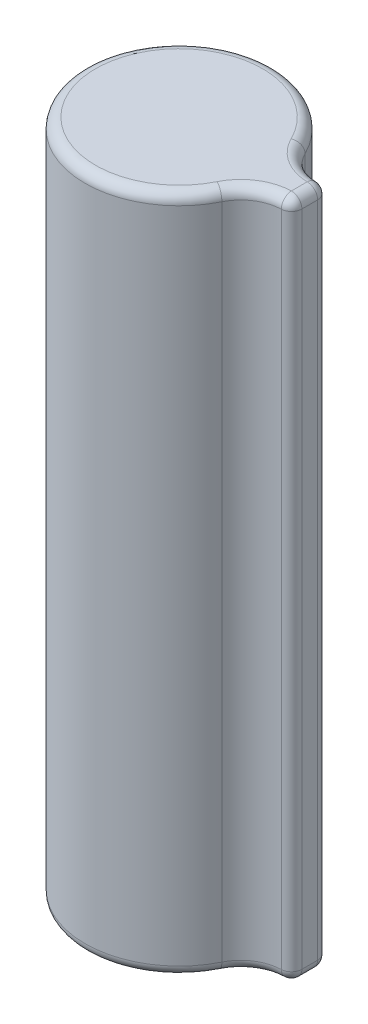
from build123d import *

# Parameters (mm, degrees)
EXTRUDE_1_DEPTH = 65
FILLET_1_R      = 4
FILLET_2_R      = 1
FILLET_3_R      = 1


with BuildPart() as part:
    # 草图1 → 凸台-拉伸1 (new body)
    with BuildSketch(Plane(origin=(0, 0, 0), x_dir=(1, 0, 0), z_dir=(0, 1, 0))):
        with BuildLine():
            Line((5.896241987, -1.75), (5.896241987, 1.75))
            Line((5.896241987, 1.75), (8.828221792, 1.75))
            ThreePointArc((8.828221792, 1.75), (-9, 0), (8.828221792, -1.75))
            Line((8.828221792, -1.75), (5.896241987, -1.75))
        make_face()
        with BuildLine():
            Line((8.828221792, 1.75), (5.896241987, 1.75))
            Line((5.896241987, 1.75), (5.896241987, -1.75))
            Line((5.896241987, -1.75), (8.828221792, -1.75))
            ThreePointArc((8.828221792, -1.75), (8.956952499, -0.879205288), (9, 0))
            ThreePointArc((9, 0), (8.956952499, 0.879205288), (8.828221792, 1.75))
        make_face()
        with BuildLine():
            Line((12.5, 1.75), (8.828221792, 1.75))
            ThreePointArc((8.828221792, 1.75), (8.956952499, 0.879205288), (9, 0))
            ThreePointArc((9, 0), (8.956952499, -0.879205288), (8.828221792, -1.75))
            Line((8.828221792, -1.75), (12.5, -1.75))
            Line((12.5, -1.75), (12.5, 1.75))
        make_face()
    extrude(amount=EXTRUDE_1_DEPTH)

    # 圆角1
    fillet_1_edges = [part.edges().sort_by_distance(p)[0] for p in [
        (8.828221792, 32.5, -1.75),
        (8.828221792, 32.5, 1.75),
    ]]
    fillet(fillet_1_edges, radius=FILLET_1_R)

    # 圆角2
    fillet_2_edges = [part.edges().sort_by_distance(p)[0] for p in [
        (12.5, 32.5, 1.75),
        (12.5, 32.5, -1.75),
    ]]
    fillet(fillet_2_edges, radius=FILLET_2_R)

    # 圆角3
    fillet_3_edges = [part.edges().sort_by_distance(p)[0] for p in [
        (-9, 0, 0),
        (-9, 65, 0),
        (9.493163732, 0, -2.387235704),
        (9.493163732, 65, 2.387235704),
        (12.5, 0, 0),
        (12.5, 65, 0),
        (9.493163732, 0, 2.387235704),
        (12.218277371, 0, -1.448292733),
        (12.218277371, 0, 1.448292733),
        (9.493163732, 65, -2.387235704),
        (12.218277371, 65, -1.448292733),
        (12.218277371, 65, 1.448292733),
    ]]
    fillet(fillet_3_edges, radius=FILLET_3_R - 0.0004)  # a hair under: the kernel refuses the full size


solid = part.part
